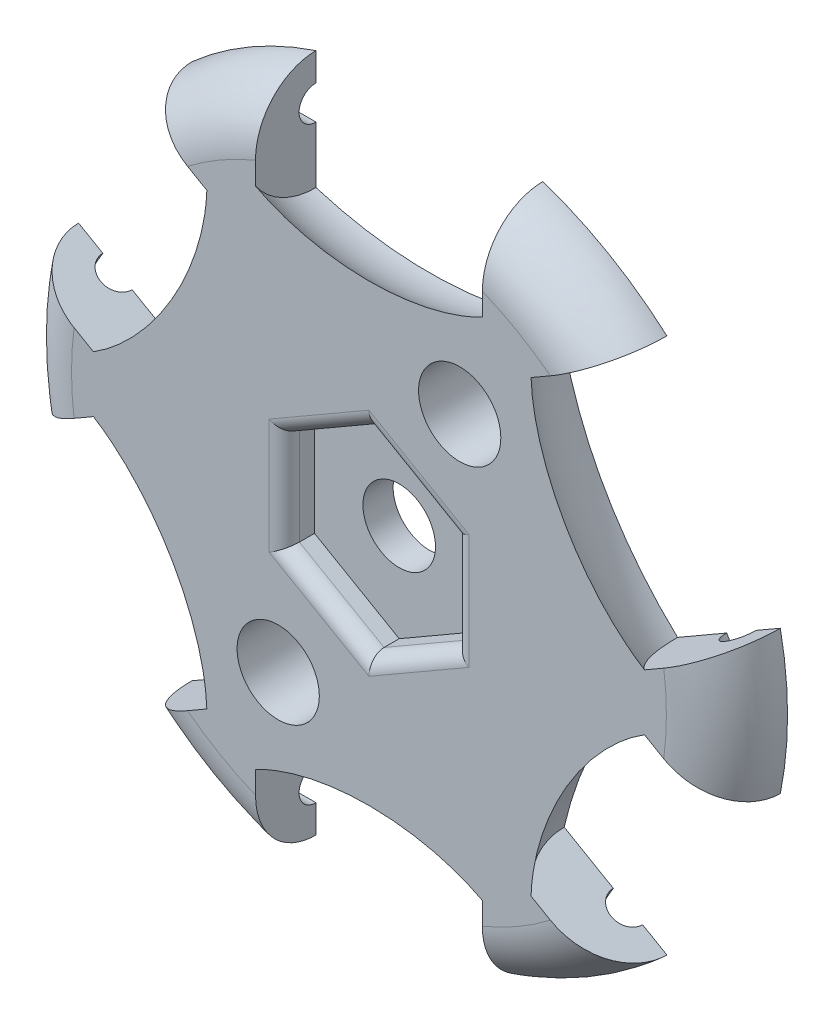
from build123d import *

# Parameters (mm, degrees)
SKETCH1_R           = 18.796
BOSS_EXTRUDE1_DEPTH = 3.175
FILLET1_R           = 3.18516
SKETCH2_R           = 2.159
SKETCH2_R_2         = 1.905
CUT_EXTRUDE1_DEPTH  = 27.770480734
SKETCH6_R           = 0.889
CUT_EXTRUDE2_DEPTH  = 7.9375
CIRPATTERN1_COUNT   = 6
CUT_EXTRUDE4_DEPTH  = 1.5875
FILLET2_R           = 0.79375


with BuildPart() as part:
    # Sketch1 → Boss-Extrude1 (new body)
    with BuildSketch(Plane.XY):
        Circle(SKETCH1_R)
    extrude(amount=BOSS_EXTRUDE1_DEPTH)

    # Fillet1
    # the kernel refuses this fillet: 3.18516 mm, written as the material it takes off along each edge
    with BuildSketch(Plane(origin=(0, 0, 3.175), x_dir=(1, 0, 0), z_dir=(0, -1, 0))) as fillet1_piece_1:
        with BuildLine():
            CenterArc((18.796 - FILLET1_R, -FILLET1_R), FILLET1_R, 0, 90)
            Line((18.796 - FILLET1_R, 0), (18.796, 0))
            Line((18.796, 0), (18.796, -FILLET1_R))
        make_face()
    revolve(axis=Axis((0, 0, 3.175), (0, 0, 1)), mode=Mode.SUBTRACT)

    # Sketch2 → Cut-Extrude1 (cut, through all)
    with BuildSketch(Plane.XY.offset(3.175)):
        with Locations((4.7625, 8.248891971)):
            Circle(SKETCH2_R)
        with Locations((-4.7625, -8.248891971)):
            Circle(SKETCH2_R)
        Circle(SKETCH2_R_2)
    extrude(amount=-CUT_EXTRUDE1_DEPTH, mode=Mode.SUBTRACT)

    # Sketch5 → Cut-Revolve1 (revolve, cut)
    with BuildSketch(Plane.XY):
        with BuildLine():
            Line((-5.953125, 15.4686), (5.953125, 15.4686))
            Line((5.953125, 15.4686), (5.953125, 19.335400434))
            ThreePointArc((5.953125, 19.335400434), (0, 20.2311), (-5.953125, 19.335400434))
            Line((-5.953125, 19.335400434), (-5.953125, 15.4686))
        make_face()
    cut_revolve1 = revolve(axis=Axis((-5.953125, 15.4686, 0), (-1, 0, 0)), mode=Mode.SUBTRACT)

    # Sketch6 → Cut-Extrude2 (cut, symmetric)
    with BuildSketch(Plane(origin=(0, 0, 0), x_dir=(0, 0, -1), z_dir=(1, 0, 0))):
        with Locations((0, 15.4686)):
            Circle(SKETCH6_R)
    cut_extrude2 = extrude(amount=CUT_EXTRUDE2_DEPTH, both=True, mode=Mode.SUBTRACT)

    # CirPattern1: Cut-Revolve1, Cut-Extrude2 ×6 about axis
    cirpattern1_axis = Axis((0, 0, 0), (0, 0, 1))
    add([cut_revolve1.rotate(cirpattern1_axis, i * 360 / CIRPATTERN1_COUNT) for i in range(1, CIRPATTERN1_COUNT)], mode=Mode.SUBTRACT)
    add([cut_extrude2.rotate(cirpattern1_axis, i * 360 / CIRPATTERN1_COUNT) for i in range(1, CIRPATTERN1_COUNT)], mode=Mode.SUBTRACT)

    # Sketch8 → Cut-Extrude4 (cut)
    with BuildSketch(Plane.XY.offset(3.175)):
        Polygon((0, 5.132643893), (-4.445, 2.566321947), (-4.445, -2.566321947), (0, -5.132643893), (4.445, -2.566321947), (4.445, 2.566321947), align=None)
    extrude(amount=-CUT_EXTRUDE4_DEPTH, mode=Mode.SUBTRACT)

    # Fillet2
    fillet2_edges = [part.edges().sort_by_distance(p)[0] for p in [
        (2.2225, 3.84948292, 3.175),
        (-2.2225, 3.84948292, 3.175),
        (-4.445, 0, 3.175),
        (-2.2225, -3.84948292, 3.175),
        (2.2225, -3.84948292, 3.175),
        (4.445, 0, 3.175),
    ]]
    fillet(fillet2_edges, radius=FILLET2_R)


solid = part.part
